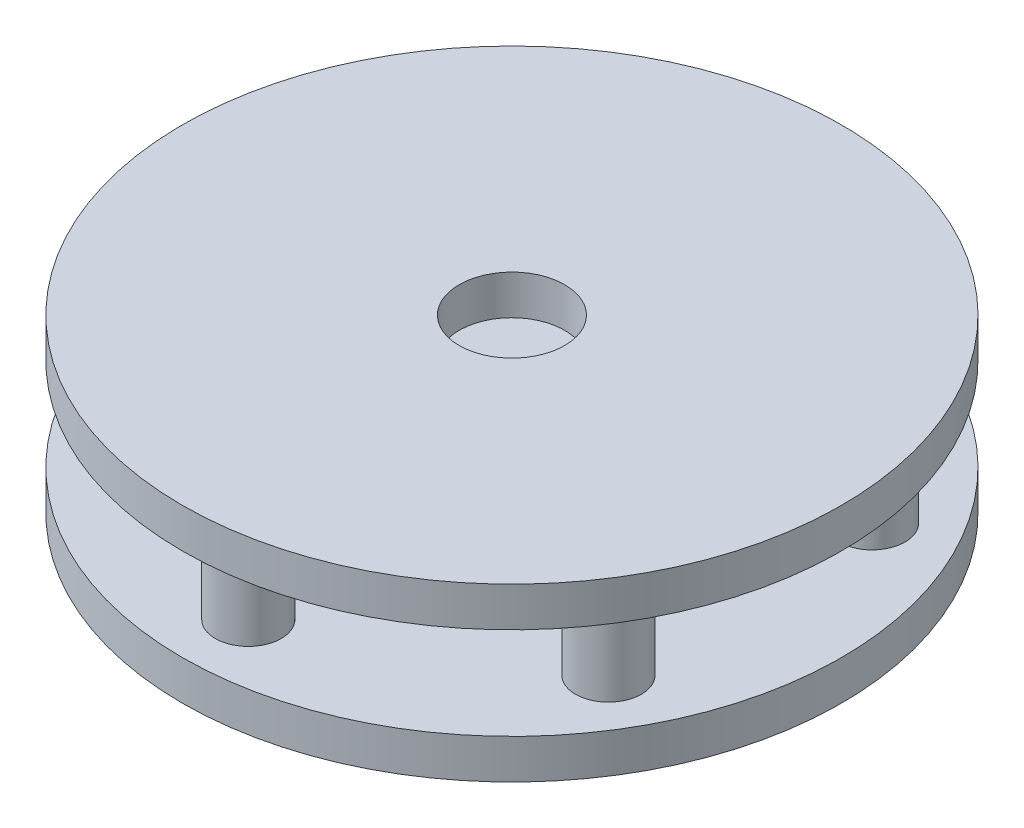
from build123d import *

# Parameters (mm, degrees)
SKETCH1_R           = 25
BOSS_EXTRUDE1_DEPTH = 3
BOSS_EXTRUDE2_DEPTH = 7
CIRPATTERN1_COUNT   = 6
SKETCH4_R           = 25
BOSS_EXTRUDE3_DEPTH = 3
SKETCH6_R           = 4
CUT_EXTRUDE1_DEPTH  = 38.669616404


with BuildPart() as part:
    # Sketch1 → Boss-Extrude1 (new body)
    with BuildSketch(Plane(origin=(0, 0, 0), x_dir=(1, 0, 0), z_dir=(0, 1, 0))):
        Circle(SKETCH1_R)
    extrude(amount=BOSS_EXTRUDE1_DEPTH)

    # Sketch3 → Boss-Extrude2 (add)
    with BuildSketch(Plane(origin=(0, 3, 0), x_dir=(1, 0, 0), z_dir=(0, 1, 0))):
        with BuildLine():
            ThreePointArc((0, 17.5), (1.767766953, 18.232233047), (2.5, 20))
            ThreePointArc((2.5, 20), (-1.767766953, 21.767766953), (0, 17.5))
        make_face()
    boss_extrude2 = extrude(amount=BOSS_EXTRUDE2_DEPTH)

    # CirPattern1: Boss-Extrude2 ×6 about axis
    cirpattern1_axis = Axis((0, 3, 0), (0, 1, 0))
    for i in range(1, CIRPATTERN1_COUNT):
        add(boss_extrude2.rotate(cirpattern1_axis, i * 360 / CIRPATTERN1_COUNT))

    # Sketch4 → Boss-Extrude3 (add)
    with BuildSketch(Plane(origin=(0, 10, 0), x_dir=(1, 0, 0), z_dir=(0, 1, 0))):
        Circle(SKETCH4_R)
    extrude(amount=BOSS_EXTRUDE3_DEPTH)

    # Sketch6 → Cut-Extrude1 (cut, through all)
    with BuildSketch(Plane(origin=(0, 13, 0), x_dir=(1, 0, 0), z_dir=(0, 1, 0))):
        Circle(SKETCH6_R)
    extrude(amount=-CUT_EXTRUDE1_DEPTH, mode=Mode.SUBTRACT)


solid = part.part
